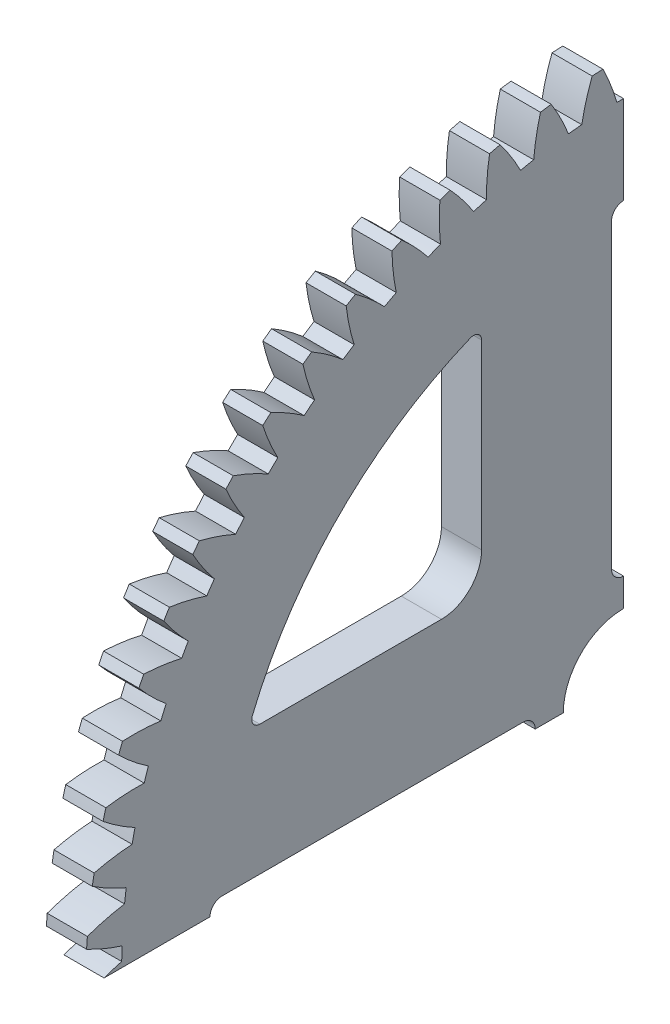
from build123d import *

# Parameters (mm, degrees)
BASPROSKE_W             = 10
BASPROSKE_H             = 134
TOOTHCUT_DEPTH          = 190.768279752
TEETHCUTS_COUNT         = 65
TEETHCUTS_ANGLE         = 354.461538462
HUBNEAONESKE_R          = 6
HUBNEARONE_DEPTH        = 40.0000508
BORSKE_R                = 4
BORE_DEPTH              = 50.0000508
ENL_V_MAT_EXTRU_1_DEPTH = 10
ENL_V_MAT_EXTRU_2_DEPTH = 5
CONG_1_R                = 10
CONG_2_R                = 2
ENL_V_MAT_EXTRU_3_DEPTH = 194.670907796
CONG_3_R                = 10
CONG_4_R                = 2
CONG_5_R                = 1
ESQUISSE5_R             = 11
ESQUISSE5_R_2           = 6
BOSS_EXTRU_1_DEPTH      = 17
CONG_6_SIZE             = 2
CONG_6_SIZE_2           = 10
BOSS_EXTRU_2_START      = -30
BOSS_EXTRU_2_DEPTH      = 30
BOSS_EXTRU_3_START      = 20.0000508
ESQUISSE7_R             = 4
BOSS_EXTRU_3_DEPTH      = 20.0000508
ENL_V_START             = -23
ESQUISSE8_R             = 6
ESQUISSE8_R_2           = 5.9
ENL_V_MAT_EXTRU_4_DEPTH = 23
ESQUISSE9_R             = 15
ENL_V_MAT_EXTRU_6_DEPTH = 192.855196601
ENL_V_MAT_EXTRU_7_DEPTH = 10


with BuildPart() as part:
    # BasProSke → Base-Revolve (revolve)
    with BuildSketch(Plane(origin=(0, 0, 0), x_dir=(1, 0, 0), z_dir=(0, 1, 0)), mode=Mode.PRIVATE) as base_revolve_sk:
        with Locations((5, 67)):
            Rectangle(BASPROSKE_W, BASPROSKE_H)
    revolve(base_revolve_sk.sketch.rotate(Axis((-10, 0, 0), (1, 0, 0)), 180), axis=Axis((-10, 0, 0), (1, 0, 0)))

    # TooCutSke → ToothCut (cut, through all)
    with BuildSketch(Plane(origin=(0, 0, 0), x_dir=(0, 0, -1), z_dir=(1, 0, 0))):
        with BuildLine():
            ThreePointArc((1.667679112, 124.987874801), (0, 124.999), (-1.667679112, 124.987874801))
            ThreePointArc((-1.667679112, 124.987874801), (-3.198590853, 129.537570146), (-5.142534786, 133.926704511))
            ThreePointArc((-5.142534786, 133.926704511), (0, 134.0254), (5.142534786, 133.926704511))
            ThreePointArc((5.142534786, 133.926704511), (3.198590853, 129.537570146), (1.667679112, 124.987874801))
        make_face()
    toothcut = extrude(amount=TOOTHCUT_DEPTH, mode=Mode.SUBTRACT)

    # TeethCuts: ToothCut ×65 about axis
    teethcuts_axis = Axis((-10, 0, 0), (1, 0, 0))
    for i in range(1, TEETHCUTS_COUNT):
        add(toothcut.rotate(teethcuts_axis, i * TEETHCUTS_ANGLE / (TEETHCUTS_COUNT - 1)), mode=Mode.SUBTRACT)

    # HubNeaOneSke → HubNearOne (add)
    with BuildSketch(Plane.ZY):
        with Locations(Location((0, 0, 0), (0, 0, 180))):
            Circle(HUBNEAONESKE_R)
    extrude(amount=HUBNEARONE_DEPTH)

    # BorSke → Bore (cut, symmetric)
    with BuildSketch(Plane(origin=(0, 0, 0), x_dir=(0, 0, -1), z_dir=(1, 0, 0))):
        with Locations(Location((0, 0, 0), (0, 0, 180))):
            Circle(BORSKE_R)
    extrude(amount=BORE_DEPTH, both=True, mode=Mode.SUBTRACT)

    # Esquisse1 → Enlèv. mat.-Extru.1 (cut)
    with BuildSketch(Plane(origin=(10, 0, 0), x_dir=(0, 0, -1), z_dir=(1, 0, 0))):
        with BuildLine():
            Line((3, 100), (3, 25))
            Line((3, 25), (-3, 25))
            Line((-3, 25), (-3, 100))
            ThreePointArc((-3, 100), (0, 103), (3, 100))
        make_face()
        with BuildLine():
            Line((-3, 25), (3, 25))
            ThreePointArc((3, 25), (0, 22), (-3, 25))
        make_face()
        with BuildLine():
            Line((100, 3), (25, 3))
            ThreePointArc((25, 3), (22, 0), (25, -3))
            Line((25, -3), (100, -3))
            ThreePointArc((100, -3), (103, 0), (100, 3))
        make_face()
        with BuildLine():
            Line((-100, -3), (-25, -3))
            ThreePointArc((-25, -3), (-22, 0), (-25, 3))
            Line((-25, 3), (-100, 3))
            ThreePointArc((-100, 3), (-103, 0), (-100, -3))
        make_face()
        with BuildLine():
            Line((3, -100), (3, -25))
            ThreePointArc((3, -25), (0, -22), (-3, -25))
            Line((-3, -25), (-3, -100))
            ThreePointArc((-3, -100), (0, -103), (3, -100))
        make_face()
    extrude(amount=-ENL_V_MAT_EXTRU_1_DEPTH, mode=Mode.SUBTRACT)

    # Esquisse3 → Enlèv. mat.-Extru.2 (cut)
    with BuildSketch(Plane.ZY):
        Polygon((-113, -8), (-113, -18), (-18, -18), (-18, -113), (-8, -113), (-8, -12), (-12, -12), (-12, -8), align=None)
        Polygon((-113, 8), (-12, 8), (-12, 12), (-8, 12), (-8, 113), (-18, 113), (-18, 18), (-113, 18), align=None)
        Polygon((8, 113), (8, 12), (12, 12), (12, 8), (113, 8), (113, 18), (18, 18), (18, 113), align=None)
        Polygon((113, -8), (12, -8), (12, -12), (8, -12), (8, -113), (18, -113), (18, -18), (113, -18), align=None)
    extrude(amount=-ENL_V_MAT_EXTRU_2_DEPTH, mode=Mode.SUBTRACT)

    # Congé1
    # the kernel refuses this fillet: 10 mm, written as the material it takes off along each edge
    with BuildSketch(Plane(origin=(-25, -18, -18), x_dir=(0, 0, -1), z_dir=(1, 0, 0)), Plane(origin=(-25, 18, -18), x_dir=(0, 1, 0), z_dir=(1, 0, 0)), Plane(origin=(-25, 18, 18), x_dir=(0, 0, 1), z_dir=(1, 0, 0)), Plane(origin=(-25, -18, 18), x_dir=(0, -1, 0), z_dir=(1, 0, 0))) as cong_1_piece_1:
        with BuildLine():
            CenterArc((CONG_1_R, -CONG_1_R), CONG_1_R, 90, 90)
            Line((0, -CONG_1_R), (0, 0))
            Line((0, 0), (CONG_1_R, 0))
        make_face()
    extrude(amount=30, mode=Mode.SUBTRACT)
    with BuildSketch(Plane(origin=(-10, -12, 12), x_dir=(0, 1, 0), z_dir=(1, 0, 0)), Plane(origin=(-10, -12, -12), x_dir=(0, 0, 1), z_dir=(1, 0, 0)), Plane(origin=(-10, 12, 12), x_dir=(0, 0, -1), z_dir=(1, 0, 0)), Plane(origin=(-10, 12, -12), x_dir=(0, -1, 0), z_dir=(1, 0, 0))) as cong_1_piece_2:
        with BuildLine():
            CenterArc((8.782329983, -8.782329983), CONG_1_R, 118.570059811, 32.859880379)
            Line((0, -4), (0, 0))
            Line((0, 0), (4, 0))
        make_face()
    extrude(amount=15, mode=Mode.SUBTRACT)

    # Congé2
    cong_2_edges = [part.edges().sort_by_distance(p)[0] for p in [
        (2.5, 18, 113),
        (2.5, 8, 113),
        (2.5, 113, 8),
        (2.5, 113, 18),
        (2.5, 8, -113),
        (2.5, 18, -113),
        (2.5, 113, -18),
        (2.5, 113, -8),
        (2.5, -8, -113),
        (2.5, -113, -8),
        (2.5, -113, -18),
        (2.5, -18, -113),
        (2.5, -113, 18),
        (2.5, -113, 8),
        (2.5, -8, 113),
        (2.5, -18, 113),
    ]]
    fillet(cong_2_edges, radius=CONG_2_R)

    # Esquisse4 → Enlèv. mat.-Extru.3 (cut, through all)
    with BuildSketch(Plane.ZY):
        with BuildLine():
            Line((-93.541434669, 35.355339059), (-35.355339059, 35.355339059))
            Line((-35.355339059, 35.355339059), (-35.355339059, 93.541434669))
            ThreePointArc((-35.355339059, 93.541434669), (-70.710678119, 70.710678119), (-93.541434669, 35.355339059))
        make_face()
        with BuildLine():
            Line((35.355339059, 93.541434669), (35.355339059, 35.355339059))
            Line((35.355339059, 35.355339059), (93.541434669, 35.355339059))
            ThreePointArc((93.541434669, 35.355339059), (70.710678119, 70.710678119), (35.355339059, 93.541434669))
        make_face()
        with BuildLine():
            Line((93.541434669, -35.355339059), (35.355339059, -35.355339059))
            Line((35.355339059, -35.355339059), (35.355339059, -93.541434669))
            ThreePointArc((35.355339059, -93.541434669), (70.710678119, -70.710678119), (93.541434669, -35.355339059))
        make_face()
        with BuildLine():
            Line((-35.355339059, -93.541434669), (-35.355339059, -35.355339059))
            Line((-35.355339059, -35.355339059), (-93.541434669, -35.355339059))
            ThreePointArc((-93.541434669, -35.355339059), (-70.710678119, -70.710678119), (-35.355339059, -93.541434669))
        make_face()
    extrude(amount=-ENL_V_MAT_EXTRU_3_DEPTH, mode=Mode.SUBTRACT)

    # Congé3
    cong_3_edges = [part.edges().sort_by_distance(p)[0] for p in [
        (5, 35.355339059, -35.355339059),
        (5, 35.355339059, 35.355339059),
        (5, -35.355339059, 35.355339059),
        (5, -35.355339059, -35.355339059),
    ]]
    fillet(cong_3_edges, radius=CONG_3_R)

    # Congé4
    cong_4_edges = [part.edges().sort_by_distance(p)[0] for p in [
        (5, 35.355339059, -93.541434669),
        (5, 93.541434669, -35.355339059),
        (5, 93.541434669, 35.355339059),
        (5, 35.355339059, 93.541434669),
        (5, -35.355339059, 93.541434669),
        (5, -93.541434669, 35.355339059),
        (5, -93.541434669, -35.355339059),
        (5, -35.355339059, -93.541434669),
    ]]
    fillet(cong_4_edges, radius=CONG_4_R)

    # Congé5
    # the kernel refuses this fillet: 1 mm, written as the material it takes off along each edge
    with BuildSketch(Plane(origin=(0, 8, 9.5), x_dir=(0, -1, 0), z_dir=(0, 0, 1))) as cong_5_piece_1_section:
        with BuildLine():
            CenterArc((CONG_5_R, CONG_5_R), CONG_5_R, 180, 90)
            Line((0, CONG_5_R), (0, 0))
            Line((0, 0), (CONG_5_R, 0))
        make_face()
    cong_5_piece_1 = extrude(amount=101.5, mode=Mode.PRIVATE)
    cong_5_piece_1 = cong_5_piece_1 - Plane(origin=(0, 3.217670017, 3.217670017), x_dir=(0, 0, -1), z_dir=(-1, 0, 0)) * Cylinder(10, 208, mode=Mode.PRIVATE)
    with BuildSketch(Plane(origin=(0, 9.5, -8), x_dir=(0, 0, 1), z_dir=(0, 1, 0))) as cong_5_piece_2_section:
        with BuildLine():
            CenterArc((CONG_5_R, CONG_5_R), CONG_5_R, 180, 90)
            Line((0, CONG_5_R), (0, 0))
            Line((0, 0), (CONG_5_R, 0))
        make_face()
    cong_5_piece_2 = extrude(amount=101.5, mode=Mode.PRIVATE)
    cong_5_piece_2 = cong_5_piece_2 - Plane(origin=(0, 3.217670017, -3.217670017), x_dir=(0, -1, 0), z_dir=(-1, 0, 0)) * Cylinder(10, 207, mode=Mode.PRIVATE)
    with BuildSketch(Plane(origin=(0, -8, -9.5), x_dir=(0, 1, 0), z_dir=(0, 0, -1))) as cong_5_piece_3_section:
        with BuildLine():
            CenterArc((CONG_5_R, CONG_5_R), CONG_5_R, 180, 90)
            Line((0, CONG_5_R), (0, 0))
            Line((0, 0), (CONG_5_R, 0))
        make_face()
    cong_5_piece_3 = extrude(amount=101.5, mode=Mode.PRIVATE)
    cong_5_piece_3 = cong_5_piece_3 - Plane(origin=(0, -3.217670017, -3.217670017), x_dir=(0, 0, 1), z_dir=(-1, 0, 0)) * Cylinder(10, 207, mode=Mode.PRIVATE)
    with BuildSketch(Plane(origin=(0, -9.5, 8), x_dir=(0, 0, -1), z_dir=(0, -1, 0))) as cong_5_piece_4_section:
        with BuildLine():
            CenterArc((CONG_5_R, CONG_5_R), CONG_5_R, 180, 90)
            Line((0, CONG_5_R), (0, 0))
            Line((0, 0), (CONG_5_R, 0))
        make_face()
    cong_5_piece_4 = extrude(amount=101.5, mode=Mode.PRIVATE)
    cong_5_piece_4 = cong_5_piece_4 - Plane(origin=(0, -3.217670017, 3.217670017), x_dir=(0, 1, 0), z_dir=(-1, 0, 0)) * Cylinder(10, 207, mode=Mode.PRIVATE)
    with BuildSketch(Plane(origin=(0, -28, -18), x_dir=(0, 0, -1), z_dir=(0, -1, 0)), Plane(origin=(0, 18, -28), x_dir=(0, 1, 0), z_dir=(0, 0, -1)), Plane(origin=(0, -18, 28), x_dir=(0, -1, 0), z_dir=(0, 0, 1)), Plane(origin=(0, 28, 18), x_dir=(0, 0, 1), z_dir=(0, 1, 0)), Plane(origin=(0, 111, -18), x_dir=(0, 0, -1), z_dir=(0, -1, 0)), Plane(origin=(0, 18, 111), x_dir=(0, 1, 0), z_dir=(0, 0, -1)), Plane(origin=(0, -111, 18), x_dir=(0, 0, 1), z_dir=(0, 1, 0)), Plane(origin=(0, -18, -111), x_dir=(0, -1, 0), z_dir=(0, 0, 1))) as cong_5_piece_5:
        with BuildLine():
            CenterArc((CONG_5_R, CONG_5_R), CONG_5_R, 180, 90)
            Line((0, CONG_5_R), (0, 0))
            Line((0, 0), (CONG_5_R, 0))
        make_face()
    cong_5_piece_5_solid = extrude(amount=83, mode=Mode.PRIVATE)
    with BuildSketch(Plane(origin=(0, 3.217670017, -3.217670017), x_dir=(0, 0.9692508920434058, -0.24607459900010414), z_dir=(0, 0.24607459900010414, 0.9692508920434058))) as cong_5_piece_6_section:
        with BuildLine():
            CenterArc((10 - CONG_5_R, -CONG_5_R), CONG_5_R, 0, 90)
            Line((10, -CONG_5_R), (10, 0))
            Line((10, 0), (10 - CONG_5_R, 0))
        make_face()
    cong_5_piece_6 = revolve(axis=Axis((0, 3.217670017, -3.217670017), (-1, 0, 0)), revolution_arc=61.509303849, mode=Mode.PRIVATE)
    cong_5_piece_6 = split(cong_5_piece_6, bisect_by=Plane(origin=(0, 8, -3.217670017), z_dir=(0, 1, 0)), keep=Keep.TOP, mode=Mode.PRIVATE)
    cong_5_piece_6 = split(cong_5_piece_6, bisect_by=Plane(origin=(0, 3.217670017, -8), z_dir=(0, 0, -1)), keep=Keep.TOP, mode=Mode.PRIVATE)
    with BuildSketch(Plane(origin=(0, 3.217670017, 3.217670017), x_dir=(0, 0.24607459900010414, 0.9692508920434058), z_dir=(0, -0.9692508920434058, 0.24607459900010414))) as cong_5_piece_7_section:
        with BuildLine():
            CenterArc((10 - CONG_5_R, -CONG_5_R), CONG_5_R, 0, 90)
            Line((10, -CONG_5_R), (10, 0))
            Line((10, 0), (10 - CONG_5_R, 0))
        make_face()
    cong_5_piece_7 = revolve(axis=Axis((0, 3.217670017, 3.217670017), (-1, 0, 0)), revolution_arc=61.509303849, mode=Mode.PRIVATE)
    cong_5_piece_7 = split(cong_5_piece_7, bisect_by=Plane(origin=(0, 3.217670017, 8), z_dir=(0, 0, 1)), keep=Keep.TOP, mode=Mode.PRIVATE)
    cong_5_piece_7 = split(cong_5_piece_7, bisect_by=Plane(origin=(0, 8, 3.217670017), z_dir=(0, 1, 0)), keep=Keep.TOP, mode=Mode.PRIVATE)
    with BuildSketch(Plane(origin=(0, -3.217670017, -3.217670017), x_dir=(0, -0.24607459900010414, -0.9692508920434058), z_dir=(0, 0.9692508920434058, -0.24607459900010414))) as cong_5_piece_8_section:
        with BuildLine():
            CenterArc((10 - CONG_5_R, -CONG_5_R), CONG_5_R, 0, 90)
            Line((10, -CONG_5_R), (10, 0))
            Line((10, 0), (10 - CONG_5_R, 0))
        make_face()
    cong_5_piece_8 = revolve(axis=Axis((0, -3.217670017, -3.217670017), (-1, 0, 0)), revolution_arc=61.509303849, mode=Mode.PRIVATE)
    cong_5_piece_8 = split(cong_5_piece_8, bisect_by=Plane(origin=(0, -8, -3.217670017), z_dir=(0, -1, 0)), keep=Keep.TOP, mode=Mode.PRIVATE)
    cong_5_piece_8 = split(cong_5_piece_8, bisect_by=Plane(origin=(0, -3.217670017, -8), z_dir=(0, 0, -1)), keep=Keep.TOP, mode=Mode.PRIVATE)
    with BuildSketch(Plane(origin=(0, -3.217670017, 3.217670017), x_dir=(0, -0.9692508920434058, 0.24607459900010414), z_dir=(0, -0.24607459900010414, -0.9692508920434058))) as cong_5_piece_9_section:
        with BuildLine():
            CenterArc((10 - CONG_5_R, -CONG_5_R), CONG_5_R, 0, 90)
            Line((10, -CONG_5_R), (10, 0))
            Line((10, 0), (10 - CONG_5_R, 0))
        make_face()
    cong_5_piece_9 = revolve(axis=Axis((0, -3.217670017, 3.217670017), (-1, 0, 0)), revolution_arc=61.509303849, mode=Mode.PRIVATE)
    cong_5_piece_9 = split(cong_5_piece_9, bisect_by=Plane(origin=(0, -8, 3.217670017), z_dir=(0, -1, 0)), keep=Keep.TOP, mode=Mode.PRIVATE)
    cong_5_piece_9 = split(cong_5_piece_9, bisect_by=Plane(origin=(0, -3.217670017, 8), z_dir=(0, 0, 1)), keep=Keep.TOP, mode=Mode.PRIVATE)
    with BuildSketch(Plane(origin=(0, -28, 28), x_dir=(0, 1, 0), z_dir=(0, 0, 1))) as cong_5_piece_10:
        with BuildLine():
            CenterArc((10 - CONG_5_R, -CONG_5_R), CONG_5_R, 0, 90)
            Line((10, -CONG_5_R), (10, 0))
            Line((10, 0), (10 - CONG_5_R, 0))
        make_face()
    cong_5_piece_10_solid = revolve(axis=Axis((0, -28, 28), (-1, 0, 0)), revolution_arc=90, mode=Mode.PRIVATE)
    with BuildSketch(Plane(origin=(0, 28, 28), x_dir=(0, 0, -1), z_dir=(0, 1, 0))) as cong_5_piece_11:
        with BuildLine():
            CenterArc((10 - CONG_5_R, -CONG_5_R), CONG_5_R, 0, 90)
            Line((10, -CONG_5_R), (10, 0))
            Line((10, 0), (10 - CONG_5_R, 0))
        make_face()
    cong_5_piece_11_solid = revolve(axis=Axis((0, 28, 28), (-1, 0, 0)), revolution_arc=90, mode=Mode.PRIVATE)
    with BuildSketch(Plane(origin=(0, 28, -28), x_dir=(0, -1, 0), z_dir=(0, 0, -1))) as cong_5_piece_12:
        with BuildLine():
            CenterArc((10 - CONG_5_R, -CONG_5_R), CONG_5_R, 0, 90)
            Line((10, -CONG_5_R), (10, 0))
            Line((10, 0), (10 - CONG_5_R, 0))
        make_face()
    cong_5_piece_12_solid = revolve(axis=Axis((0, 28, -28), (-1, 0, 0)), revolution_arc=90, mode=Mode.PRIVATE)
    with BuildSketch(Plane(origin=(0, -28, -28), x_dir=(0, 0, 1), z_dir=(0, -1, 0))) as cong_5_piece_13:
        with BuildLine():
            CenterArc((10 - CONG_5_R, -CONG_5_R), CONG_5_R, 0, 90)
            Line((10, -CONG_5_R), (10, 0))
            Line((10, 0), (10 - CONG_5_R, 0))
        make_face()
    cong_5_piece_13_solid = revolve(axis=Axis((0, -28, -28), (-1, 0, 0)), revolution_arc=90, mode=Mode.PRIVATE)
    with BuildSketch(Plane(origin=(0, 113, -10), x_dir=(0, 1, 0), z_dir=(0, 0, -1)), Plane(origin=(0, 113, 16), x_dir=(0, 1, 0), z_dir=(0, 0, -1)), Plane(origin=(0, 10, 113), x_dir=(0, 0, 1), z_dir=(0, 1, 0)), Plane(origin=(0, -16, 113), x_dir=(0, 0, 1), z_dir=(0, 1, 0)), Plane(origin=(0, -113, 10), x_dir=(0, -1, 0), z_dir=(0, 0, 1)), Plane(origin=(0, -113, -16), x_dir=(0, -1, 0), z_dir=(0, 0, 1)), Plane(origin=(0, -10, -113), x_dir=(0, 0, -1), z_dir=(0, -1, 0)), Plane(origin=(0, 16, -113), x_dir=(0, 0, -1), z_dir=(0, -1, 0))) as cong_5_piece_14:
        with BuildLine():
            CenterArc((CONG_5_R, CONG_5_R), CONG_5_R, 180, 90)
            Line((0, CONG_5_R), (0, 0))
            Line((0, 0), (CONG_5_R, 0))
        make_face()
    cong_5_piece_14_solid = extrude(amount=6, mode=Mode.PRIVATE)
    with BuildSketch(Plane(origin=(0, 111, 8), x_dir=(0, 0, -1), z_dir=(0, -1, 0))) as cong_5_piece_15_section:
        with BuildLine():
            CenterArc((CONG_5_R, CONG_5_R), CONG_5_R, 180, 90)
            Line((0, CONG_5_R), (0, 0))
            Line((0, 0), (CONG_5_R, 0))
        make_face()
    cong_5_piece_15 = extrude(amount=101.5, mode=Mode.PRIVATE)
    cong_5_piece_15 = cong_5_piece_15 - Plane(origin=(0, 3.217670017, 3.217670017), x_dir=(0, 0, -1), z_dir=(-1, 0, 0)) * Cylinder(10, 207, mode=Mode.PRIVATE)
    with BuildSketch(Plane(origin=(0, -8, 111), x_dir=(0, 1, 0), z_dir=(0, 0, -1))) as cong_5_piece_16_section:
        with BuildLine():
            CenterArc((CONG_5_R, CONG_5_R), CONG_5_R, 180, 90)
            Line((0, CONG_5_R), (0, 0))
            Line((0, 0), (CONG_5_R, 0))
        make_face()
    cong_5_piece_16 = extrude(amount=101.5, mode=Mode.PRIVATE)
    cong_5_piece_16 = cong_5_piece_16 - Plane(origin=(0, -3.217670017, 3.217670017), x_dir=(0, 1, 0), z_dir=(-1, 0, 0)) * Cylinder(10, 207, mode=Mode.PRIVATE)
    with BuildSketch(Plane(origin=(0, -111, -8), x_dir=(0, 0, 1), z_dir=(0, 1, 0))) as cong_5_piece_17_section:
        with BuildLine():
            CenterArc((CONG_5_R, CONG_5_R), CONG_5_R, 180, 90)
            Line((0, CONG_5_R), (0, 0))
            Line((0, 0), (CONG_5_R, 0))
        make_face()
    cong_5_piece_17 = extrude(amount=101.5, mode=Mode.PRIVATE)
    cong_5_piece_17 = cong_5_piece_17 - Plane(origin=(0, -3.217670017, -3.217670017), x_dir=(0, 0, 1), z_dir=(-1, 0, 0)) * Cylinder(10, 207, mode=Mode.PRIVATE)
    with BuildSketch(Plane(origin=(0, 8, -111), x_dir=(0, -1, 0), z_dir=(0, 0, 1))) as cong_5_piece_18_section:
        with BuildLine():
            CenterArc((CONG_5_R, CONG_5_R), CONG_5_R, 180, 90)
            Line((0, CONG_5_R), (0, 0))
            Line((0, 0), (CONG_5_R, 0))
        make_face()
    cong_5_piece_18 = extrude(amount=101.5, mode=Mode.PRIVATE)
    cong_5_piece_18 = cong_5_piece_18 - Plane(origin=(0, 3.217670017, -3.217670017), x_dir=(0, -1, 0), z_dir=(-1, 0, 0)) * Cylinder(10, 207, mode=Mode.PRIVATE)
    with BuildSketch(Plane(origin=(0, 111, -16), x_dir=(0, 1, 0), z_dir=(0, 0, 1))) as cong_5_piece_19:
        with BuildLine():
            CenterArc((2 + CONG_5_R, -CONG_5_R), CONG_5_R, 90, 90)
            Line((2, -CONG_5_R), (2, 0))
            Line((2, 0), (2 + CONG_5_R, 0))
        make_face()
    cong_5_piece_19_solid = revolve(axis=Axis((0, 111, -16), (-1, 0, 0)), revolution_arc=90, mode=Mode.PRIVATE)
    with BuildSketch(Plane(origin=(0, 111, -10), x_dir=(0, 0, 1), z_dir=(0, -1, 0))) as cong_5_piece_20:
        with BuildLine():
            CenterArc((2 + CONG_5_R, -CONG_5_R), CONG_5_R, 90, 90)
            Line((2, -CONG_5_R), (2, 0))
            Line((2, 0), (2 + CONG_5_R, 0))
        make_face()
    cong_5_piece_20_solid = revolve(axis=Axis((0, 111, -10), (-1, 0, 0)), revolution_arc=90, mode=Mode.PRIVATE)
    with BuildSketch(Plane(origin=(0, 111, 10), x_dir=(0, 0, -1), z_dir=(0, -1, 0))) as cong_5_piece_21:
        with BuildLine():
            CenterArc((2 + CONG_5_R, CONG_5_R), CONG_5_R, 180, 90)
            Line((2, CONG_5_R), (2, 0))
            Line((2, 0), (2 + CONG_5_R, 0))
        make_face()
    cong_5_piece_21_solid = revolve(axis=Axis((0, 111, 10), (1, 0, 0)), revolution_arc=90, mode=Mode.PRIVATE)
    with BuildSketch(Plane(origin=(0, 111, 16), x_dir=(0, 0, 1), z_dir=(0, -1, 0))) as cong_5_piece_22:
        with BuildLine():
            CenterArc((2 + CONG_5_R, -CONG_5_R), CONG_5_R, 90, 90)
            Line((2, -CONG_5_R), (2, 0))
            Line((2, 0), (2 + CONG_5_R, 0))
        make_face()
    cong_5_piece_22_solid = revolve(axis=Axis((0, 111, 16), (-1, 0, 0)), revolution_arc=90, mode=Mode.PRIVATE)
    with BuildSketch(Plane(origin=(0, 16, 111), x_dir=(0, 0, 1), z_dir=(0, -1, 0))) as cong_5_piece_23:
        with BuildLine():
            CenterArc((2 + CONG_5_R, -CONG_5_R), CONG_5_R, 90, 90)
            Line((2, -CONG_5_R), (2, 0))
            Line((2, 0), (2 + CONG_5_R, 0))
        make_face()
    cong_5_piece_23_solid = revolve(axis=Axis((0, 16, 111), (-1, 0, 0)), revolution_arc=90, mode=Mode.PRIVATE)
    with BuildSketch(Plane(origin=(0, 10, 111), x_dir=(0, -1, 0), z_dir=(0, 0, -1))) as cong_5_piece_24:
        with BuildLine():
            CenterArc((2 + CONG_5_R, -CONG_5_R), CONG_5_R, 90, 90)
            Line((2, -CONG_5_R), (2, 0))
            Line((2, 0), (2 + CONG_5_R, 0))
        make_face()
    cong_5_piece_24_solid = revolve(axis=Axis((0, 10, 111), (-1, 0, 0)), revolution_arc=90, mode=Mode.PRIVATE)
    with BuildSketch(Plane(origin=(0, -10, 111), x_dir=(0, 1, 0), z_dir=(0, 0, -1))) as cong_5_piece_25:
        with BuildLine():
            CenterArc((2 + CONG_5_R, CONG_5_R), CONG_5_R, 180, 90)
            Line((2, CONG_5_R), (2, 0))
            Line((2, 0), (2 + CONG_5_R, 0))
        make_face()
    cong_5_piece_25_solid = revolve(axis=Axis((0, -10, 111), (1, 0, 0)), revolution_arc=90, mode=Mode.PRIVATE)
    with BuildSketch(Plane(origin=(0, -16, 111), x_dir=(0, -1, 0), z_dir=(0, 0, -1))) as cong_5_piece_26:
        with BuildLine():
            CenterArc((2 + CONG_5_R, -CONG_5_R), CONG_5_R, 90, 90)
            Line((2, -CONG_5_R), (2, 0))
            Line((2, 0), (2 + CONG_5_R, 0))
        make_face()
    cong_5_piece_26_solid = revolve(axis=Axis((0, -16, 111), (-1, 0, 0)), revolution_arc=90, mode=Mode.PRIVATE)
    with BuildSketch(Plane(origin=(0, -111, 16), x_dir=(0, -1, 0), z_dir=(0, 0, -1))) as cong_5_piece_27:
        with BuildLine():
            CenterArc((2 + CONG_5_R, -CONG_5_R), CONG_5_R, 90, 90)
            Line((2, -CONG_5_R), (2, 0))
            Line((2, 0), (2 + CONG_5_R, 0))
        make_face()
    cong_5_piece_27_solid = revolve(axis=Axis((0, -111, 16), (-1, 0, 0)), revolution_arc=90, mode=Mode.PRIVATE)
    with BuildSketch(Plane(origin=(0, -111, 10), x_dir=(0, 0, -1), z_dir=(0, 1, 0))) as cong_5_piece_28:
        with BuildLine():
            CenterArc((2 + CONG_5_R, -CONG_5_R), CONG_5_R, 90, 90)
            Line((2, -CONG_5_R), (2, 0))
            Line((2, 0), (2 + CONG_5_R, 0))
        make_face()
    cong_5_piece_28_solid = revolve(axis=Axis((0, -111, 10), (-1, 0, 0)), revolution_arc=90, mode=Mode.PRIVATE)
    with BuildSketch(Plane(origin=(0, -111, -10), x_dir=(0, -1, 0), z_dir=(0, 0, -1))) as cong_5_piece_29:
        with BuildLine():
            CenterArc((2 + CONG_5_R, -CONG_5_R), CONG_5_R, 90, 90)
            Line((2, -CONG_5_R), (2, 0))
            Line((2, 0), (2 + CONG_5_R, 0))
        make_face()
    cong_5_piece_29_solid = revolve(axis=Axis((0, -111, -10), (-1, 0, 0)), revolution_arc=90, mode=Mode.PRIVATE)
    with BuildSketch(Plane(origin=(0, -111, -16), x_dir=(0, 0, -1), z_dir=(0, 1, 0))) as cong_5_piece_30:
        with BuildLine():
            CenterArc((2 + CONG_5_R, -CONG_5_R), CONG_5_R, 90, 90)
            Line((2, -CONG_5_R), (2, 0))
            Line((2, 0), (2 + CONG_5_R, 0))
        make_face()
    cong_5_piece_30_solid = revolve(axis=Axis((0, -111, -16), (-1, 0, 0)), revolution_arc=90, mode=Mode.PRIVATE)
    with BuildSketch(Plane(origin=(0, -16, -111), x_dir=(0, 0, -1), z_dir=(0, 1, 0))) as cong_5_piece_31:
        with BuildLine():
            CenterArc((2 + CONG_5_R, -CONG_5_R), CONG_5_R, 90, 90)
            Line((2, -CONG_5_R), (2, 0))
            Line((2, 0), (2 + CONG_5_R, 0))
        make_face()
    cong_5_piece_31_solid = revolve(axis=Axis((0, -16, -111), (-1, 0, 0)), revolution_arc=90, mode=Mode.PRIVATE)
    with BuildSketch(Plane(origin=(0, -10, -111), x_dir=(0, 0, -1), z_dir=(0, -1, 0))) as cong_5_piece_32:
        with BuildLine():
            CenterArc((2 + CONG_5_R, CONG_5_R), CONG_5_R, 180, 90)
            Line((2, CONG_5_R), (2, 0))
            Line((2, 0), (2 + CONG_5_R, 0))
        make_face()
    cong_5_piece_32_solid = revolve(axis=Axis((0, -10, -111), (1, 0, 0)), revolution_arc=90, mode=Mode.PRIVATE)
    with BuildSketch(Plane(origin=(0, 10, -111), x_dir=(0, -1, 0), z_dir=(0, 0, 1))) as cong_5_piece_33:
        with BuildLine():
            CenterArc((2 + CONG_5_R, CONG_5_R), CONG_5_R, 180, 90)
            Line((2, CONG_5_R), (2, 0))
            Line((2, 0), (2 + CONG_5_R, 0))
        make_face()
    cong_5_piece_33_solid = revolve(axis=Axis((0, 10, -111), (1, 0, 0)), revolution_arc=90, mode=Mode.PRIVATE)
    with BuildSketch(Plane(origin=(0, 16, -111), x_dir=(0, 1, 0), z_dir=(0, 0, 1))) as cong_5_piece_34:
        with BuildLine():
            CenterArc((2 + CONG_5_R, -CONG_5_R), CONG_5_R, 90, 90)
            Line((2, -CONG_5_R), (2, 0))
            Line((2, 0), (2 + CONG_5_R, 0))
        make_face()
    cong_5_piece_34_solid = revolve(axis=Axis((0, 16, -111), (-1, 0, 0)), revolution_arc=90, mode=Mode.PRIVATE)
    with BuildSketch(Plane(origin=(0, 3.217670017, 3.217670017), x_dir=(0, 0.24607459900010414, 0.9692508920434058), z_dir=(0, -0.9692508920434058, 0.24607459900010414))) as cong_5_piece_35a_section:
        with BuildLine():
            CenterArc((10 - CONG_5_R, -CONG_5_R), CONG_5_R, 0, 90)
            Line((10, -CONG_5_R), (10, 0))
            Line((10, 0), (10 - CONG_5_R, 0))
        make_face()
    cong_5_piece_35a = revolve(axis=Axis((0, 3.217670017, 3.217670017), (-1, 0, 0)), revolution_arc=61.509303849, mode=Mode.PRIVATE)
    cong_5_piece_35a = split(cong_5_piece_35a, bisect_by=Plane(origin=(0, 8, 3.217670017), z_dir=(0, -1, 0)), keep=Keep.TOP, mode=Mode.PRIVATE)
    with BuildSketch(Plane(origin=(0, 8, 9.5), x_dir=(0, -1, 0), z_dir=(0, 0, 1))) as cong_5_piece_35b_section:
        with BuildLine():
            CenterArc((CONG_5_R, CONG_5_R), CONG_5_R, 180, 90)
            Line((0, CONG_5_R), (0, 0))
            Line((0, 0), (CONG_5_R, 0))
        make_face()
    cong_5_piece_35b = extrude(amount=101.5, mode=Mode.PRIVATE)
    cong_5_piece_35b = cong_5_piece_35b & Plane(origin=(0, 3.217670017, 3.217670017), x_dir=(0, 0, -1), z_dir=(-1, 0, 0)) * Cylinder(10, 208, mode=Mode.PRIVATE)
    cong_5_piece_35 = cong_5_piece_35a & cong_5_piece_35b
    with BuildSketch(Plane(origin=(0, 3.217670017, -3.217670017), x_dir=(0, 0.9692508920434058, -0.24607459900010414), z_dir=(0, 0.24607459900010414, 0.9692508920434058))) as cong_5_piece_36a_section:
        with BuildLine():
            CenterArc((10 - CONG_5_R, -CONG_5_R), CONG_5_R, 0, 90)
            Line((10, -CONG_5_R), (10, 0))
            Line((10, 0), (10 - CONG_5_R, 0))
        make_face()
    cong_5_piece_36a = revolve(axis=Axis((0, 3.217670017, -3.217670017), (-1, 0, 0)), revolution_arc=61.509303849, mode=Mode.PRIVATE)
    cong_5_piece_36a = split(cong_5_piece_36a, bisect_by=Plane(origin=(0, 3.217670017, -8), z_dir=(0, 0, 1)), keep=Keep.TOP, mode=Mode.PRIVATE)
    with BuildSketch(Plane(origin=(0, 9.5, -8), x_dir=(0, 0, 1), z_dir=(0, 1, 0))) as cong_5_piece_36b_section:
        with BuildLine():
            CenterArc((CONG_5_R, CONG_5_R), CONG_5_R, 180, 90)
            Line((0, CONG_5_R), (0, 0))
            Line((0, 0), (CONG_5_R, 0))
        make_face()
    cong_5_piece_36b = extrude(amount=101.5, mode=Mode.PRIVATE)
    cong_5_piece_36b = cong_5_piece_36b & Plane(origin=(0, 3.217670017, -3.217670017), x_dir=(0, -1, 0), z_dir=(-1, 0, 0)) * Cylinder(10, 207, mode=Mode.PRIVATE)
    cong_5_piece_36 = cong_5_piece_36a & cong_5_piece_36b
    with BuildSketch(Plane(origin=(0, -8, -9.5), x_dir=(0, 1, 0), z_dir=(0, 0, -1))) as cong_5_piece_37a_section:
        with BuildLine():
            CenterArc((CONG_5_R, CONG_5_R), CONG_5_R, 180, 90)
            Line((0, CONG_5_R), (0, 0))
            Line((0, 0), (CONG_5_R, 0))
        make_face()
    cong_5_piece_37a = extrude(amount=101.5, mode=Mode.PRIVATE)
    cong_5_piece_37a = cong_5_piece_37a & Plane(origin=(0, -3.217670017, -3.217670017), x_dir=(0, 0, 1), z_dir=(-1, 0, 0)) * Cylinder(10, 207, mode=Mode.PRIVATE)
    with BuildSketch(Plane(origin=(0, -3.217670017, -3.217670017), x_dir=(0, -0.24607459900010414, -0.9692508920434058), z_dir=(0, 0.9692508920434058, -0.24607459900010414))) as cong_5_piece_37b_section:
        with BuildLine():
            CenterArc((10 - CONG_5_R, -CONG_5_R), CONG_5_R, 0, 90)
            Line((10, -CONG_5_R), (10, 0))
            Line((10, 0), (10 - CONG_5_R, 0))
        make_face()
    cong_5_piece_37b = revolve(axis=Axis((0, -3.217670017, -3.217670017), (-1, 0, 0)), revolution_arc=61.509303849, mode=Mode.PRIVATE)
    cong_5_piece_37b = split(cong_5_piece_37b, bisect_by=Plane(origin=(0, -8, -3.217670017), z_dir=(0, 1, 0)), keep=Keep.TOP, mode=Mode.PRIVATE)
    cong_5_piece_37 = cong_5_piece_37a & cong_5_piece_37b
    with BuildSketch(Plane(origin=(0, -3.217670017, 3.217670017), x_dir=(0, -0.9692508920434058, 0.24607459900010414), z_dir=(0, -0.24607459900010414, -0.9692508920434058))) as cong_5_piece_38a_section:
        with BuildLine():
            CenterArc((10 - CONG_5_R, -CONG_5_R), CONG_5_R, 0, 90)
            Line((10, -CONG_5_R), (10, 0))
            Line((10, 0), (10 - CONG_5_R, 0))
        make_face()
    cong_5_piece_38a = revolve(axis=Axis((0, -3.217670017, 3.217670017), (-1, 0, 0)), revolution_arc=61.509303849, mode=Mode.PRIVATE)
    cong_5_piece_38a = split(cong_5_piece_38a, bisect_by=Plane(origin=(0, -3.217670017, 8), z_dir=(0, 0, -1)), keep=Keep.TOP, mode=Mode.PRIVATE)
    with BuildSketch(Plane(origin=(0, -9.5, 8), x_dir=(0, 0, -1), z_dir=(0, -1, 0))) as cong_5_piece_38b_section:
        with BuildLine():
            CenterArc((CONG_5_R, CONG_5_R), CONG_5_R, 180, 90)
            Line((0, CONG_5_R), (0, 0))
            Line((0, 0), (CONG_5_R, 0))
        make_face()
    cong_5_piece_38b = extrude(amount=101.5, mode=Mode.PRIVATE)
    cong_5_piece_38b = cong_5_piece_38b & Plane(origin=(0, -3.217670017, 3.217670017), x_dir=(0, 1, 0), z_dir=(-1, 0, 0)) * Cylinder(10, 207, mode=Mode.PRIVATE)
    cong_5_piece_38 = cong_5_piece_38a & cong_5_piece_38b
    with BuildSketch(Plane(origin=(0, 8, -111), x_dir=(0, -1, 0), z_dir=(0, 0, 1))) as cong_5_piece_39a_section:
        with BuildLine():
            CenterArc((CONG_5_R, CONG_5_R), CONG_5_R, 180, 90)
            Line((0, CONG_5_R), (0, 0))
            Line((0, 0), (CONG_5_R, 0))
        make_face()
    cong_5_piece_39a = extrude(amount=101.5, mode=Mode.PRIVATE)
    cong_5_piece_39a = cong_5_piece_39a & Plane(origin=(0, 3.217670017, -3.217670017), x_dir=(0, -1, 0), z_dir=(-1, 0, 0)) * Cylinder(10, 207, mode=Mode.PRIVATE)
    with BuildSketch(Plane(origin=(0, 3.217670017, -3.217670017), x_dir=(0, 0.9692508920434058, -0.24607459900010414), z_dir=(0, 0.24607459900010414, 0.9692508920434058))) as cong_5_piece_39b_section:
        with BuildLine():
            CenterArc((10 - CONG_5_R, -CONG_5_R), CONG_5_R, 0, 90)
            Line((10, -CONG_5_R), (10, 0))
            Line((10, 0), (10 - CONG_5_R, 0))
        make_face()
    cong_5_piece_39b = revolve(axis=Axis((0, 3.217670017, -3.217670017), (-1, 0, 0)), revolution_arc=61.509303849, mode=Mode.PRIVATE)
    cong_5_piece_39b = split(cong_5_piece_39b, bisect_by=Plane(origin=(0, 8, -3.217670017), z_dir=(0, -1, 0)), keep=Keep.TOP, mode=Mode.PRIVATE)
    cong_5_piece_39 = cong_5_piece_39a & cong_5_piece_39b
    with BuildSketch(Plane(origin=(0, 111, 8), x_dir=(0, 0, -1), z_dir=(0, -1, 0))) as cong_5_piece_40a_section:
        with BuildLine():
            CenterArc((CONG_5_R, CONG_5_R), CONG_5_R, 180, 90)
            Line((0, CONG_5_R), (0, 0))
            Line((0, 0), (CONG_5_R, 0))
        make_face()
    cong_5_piece_40a = extrude(amount=101.5, mode=Mode.PRIVATE)
    cong_5_piece_40a = cong_5_piece_40a & Plane(origin=(0, 3.217670017, 3.217670017), x_dir=(0, 0, -1), z_dir=(-1, 0, 0)) * Cylinder(10, 207, mode=Mode.PRIVATE)
    with BuildSketch(Plane(origin=(0, 3.217670017, 3.217670017), x_dir=(0, 0.24607459900010414, 0.9692508920434058), z_dir=(0, -0.9692508920434058, 0.24607459900010414))) as cong_5_piece_40b_section:
        with BuildLine():
            CenterArc((10 - CONG_5_R, -CONG_5_R), CONG_5_R, 0, 90)
            Line((10, -CONG_5_R), (10, 0))
            Line((10, 0), (10 - CONG_5_R, 0))
        make_face()
    cong_5_piece_40b = revolve(axis=Axis((0, 3.217670017, 3.217670017), (-1, 0, 0)), revolution_arc=61.509303849, mode=Mode.PRIVATE)
    cong_5_piece_40b = split(cong_5_piece_40b, bisect_by=Plane(origin=(0, 3.217670017, 8), z_dir=(0, 0, -1)), keep=Keep.TOP, mode=Mode.PRIVATE)
    cong_5_piece_40 = cong_5_piece_40a & cong_5_piece_40b
    with BuildSketch(Plane(origin=(0, -3.217670017, -3.217670017), x_dir=(0, -0.24607459900010414, -0.9692508920434058), z_dir=(0, 0.9692508920434058, -0.24607459900010414))) as cong_5_piece_41a_section:
        with BuildLine():
            CenterArc((10 - CONG_5_R, -CONG_5_R), CONG_5_R, 0, 90)
            Line((10, -CONG_5_R), (10, 0))
            Line((10, 0), (10 - CONG_5_R, 0))
        make_face()
    cong_5_piece_41a = revolve(axis=Axis((0, -3.217670017, -3.217670017), (-1, 0, 0)), revolution_arc=61.509303849, mode=Mode.PRIVATE)
    cong_5_piece_41a = split(cong_5_piece_41a, bisect_by=Plane(origin=(0, -3.217670017, -8), z_dir=(0, 0, 1)), keep=Keep.TOP, mode=Mode.PRIVATE)
    with BuildSketch(Plane(origin=(0, -111, -8), x_dir=(0, 0, 1), z_dir=(0, 1, 0))) as cong_5_piece_41b_section:
        with BuildLine():
            CenterArc((CONG_5_R, CONG_5_R), CONG_5_R, 180, 90)
            Line((0, CONG_5_R), (0, 0))
            Line((0, 0), (CONG_5_R, 0))
        make_face()
    cong_5_piece_41b = extrude(amount=101.5, mode=Mode.PRIVATE)
    cong_5_piece_41b = cong_5_piece_41b & Plane(origin=(0, -3.217670017, -3.217670017), x_dir=(0, 0, 1), z_dir=(-1, 0, 0)) * Cylinder(10, 207, mode=Mode.PRIVATE)
    cong_5_piece_41 = cong_5_piece_41a & cong_5_piece_41b
    with BuildSketch(Plane(origin=(0, -8, 111), x_dir=(0, 1, 0), z_dir=(0, 0, -1))) as cong_5_piece_42a_section:
        with BuildLine():
            CenterArc((CONG_5_R, CONG_5_R), CONG_5_R, 180, 90)
            Line((0, CONG_5_R), (0, 0))
            Line((0, 0), (CONG_5_R, 0))
        make_face()
    cong_5_piece_42a = extrude(amount=101.5, mode=Mode.PRIVATE)
    cong_5_piece_42a = cong_5_piece_42a & Plane(origin=(0, -3.217670017, 3.217670017), x_dir=(0, 1, 0), z_dir=(-1, 0, 0)) * Cylinder(10, 207, mode=Mode.PRIVATE)
    with BuildSketch(Plane(origin=(0, -3.217670017, 3.217670017), x_dir=(0, -0.9692508920434058, 0.24607459900010414), z_dir=(0, -0.24607459900010414, -0.9692508920434058))) as cong_5_piece_42b_section:
        with BuildLine():
            CenterArc((10 - CONG_5_R, -CONG_5_R), CONG_5_R, 0, 90)
            Line((10, -CONG_5_R), (10, 0))
            Line((10, 0), (10 - CONG_5_R, 0))
        make_face()
    cong_5_piece_42b = revolve(axis=Axis((0, -3.217670017, 3.217670017), (-1, 0, 0)), revolution_arc=61.509303849, mode=Mode.PRIVATE)
    cong_5_piece_42b = split(cong_5_piece_42b, bisect_by=Plane(origin=(0, -8, 3.217670017), z_dir=(0, 1, 0)), keep=Keep.TOP, mode=Mode.PRIVATE)
    cong_5_piece_42 = cong_5_piece_42a & cong_5_piece_42b
    add([cong_5_piece_1, cong_5_piece_2, cong_5_piece_3, cong_5_piece_4, cong_5_piece_5_solid, cong_5_piece_6, cong_5_piece_7, cong_5_piece_8, cong_5_piece_9, cong_5_piece_10_solid, cong_5_piece_11_solid, cong_5_piece_12_solid, cong_5_piece_13_solid, cong_5_piece_14_solid, cong_5_piece_15, cong_5_piece_16, cong_5_piece_17, cong_5_piece_18, cong_5_piece_19_solid, cong_5_piece_20_solid, cong_5_piece_21_solid, cong_5_piece_22_solid, cong_5_piece_23_solid, cong_5_piece_24_solid, cong_5_piece_25_solid, cong_5_piece_26_solid, cong_5_piece_27_solid, cong_5_piece_28_solid, cong_5_piece_29_solid, cong_5_piece_30_solid, cong_5_piece_31_solid, cong_5_piece_32_solid, cong_5_piece_33_solid, cong_5_piece_34_solid, cong_5_piece_35, cong_5_piece_36, cong_5_piece_37, cong_5_piece_38, cong_5_piece_39, cong_5_piece_40, cong_5_piece_41, cong_5_piece_42], mode=Mode.SUBTRACT)

    # Esquisse5 → Boss.-Extru.1 (add)
    with BuildSketch(Plane.ZY):
        with Locations(Location((0, 0, 0), (0, 0, 180))):
            Circle(ESQUISSE5_R)
        Circle(ESQUISSE5_R_2, mode=Mode.SUBTRACT)
    extrude(amount=BOSS_EXTRU_1_DEPTH)

    # Congé6
    # a fillet whose section is not a circle: 10, 2 mm, written as the material it adds along each edge
    with BuildSketch(Plane(origin=(0, 0, 0), x_dir=(0, 0, -1), z_dir=(0, 1, 0))) as cong_6_piece_1:
        with BuildLine():
            Bezier((11 + CONG_6_SIZE, 0), (11, 0), (11, CONG_6_SIZE_2), weights=[1, 0.707106781, 1])
            Line((11, CONG_6_SIZE_2), (11, 0))
            Line((11, 0), (11 + CONG_6_SIZE, 0))
        make_face()
    revolve(axis=Axis((0, 0, 0), (-1, 0, 0)))

    # Esquisse6 → Boss.-Extru.2 (add)
    with BuildSketch(Plane.ZY.offset(40.0000508).offset(BOSS_EXTRU_2_START)):
        with BuildLine():
            ThreePointArc((2.645751311, 3), (0, 4), (-2.645751311, 3))
            Line((-2.645751311, 3), (2.645751311, 3))
        make_face()
    extrude(amount=BOSS_EXTRU_2_DEPTH)

    # Esquisse7 → Boss.-Extru.3 (add)
    with BuildSketch(Plane(origin=(-10.0000508, 0, 0), x_dir=(0, 0, -1), z_dir=(1, 0, 0)).offset(BOSS_EXTRU_3_START)):
        Circle(ESQUISSE7_R)
    extrude(amount=-BOSS_EXTRU_3_DEPTH)

    # Esquisse8 → Enlèv. mat.-Extru.4 (cut)
    with BuildSketch(Plane.ZY.offset(40.0000508).offset(ENL_V_START)):
        Circle(ESQUISSE8_R)
        Circle(ESQUISSE8_R_2, mode=Mode.SUBTRACT)
    extrude(amount=ENL_V_MAT_EXTRU_4_DEPTH, mode=Mode.SUBTRACT)

    # Esquisse9 → Enlèv. mat.-Extru.6 (cut, through all)
    with BuildSketch(Plane.ZY.offset(10.0000508)):
        Circle(ESQUISSE9_R)
    extrude(amount=-ENL_V_MAT_EXTRU_6_DEPTH, mode=Mode.SUBTRACT)


with BuildPart() as enl_v_mat_extru_6_kept_piece:
    # of the separate pieces the step leaves, the one the design keeps (enl_v_mat_extru_6_pieces_kept)
    add(part.part.solids().sort_by_distance((0, 133.901763183, -5.130089326))[0])

    # Esquisse10 → Enlèv. mat.-Extru.7 (cut)
    with BuildSketch(Plane.ZY):
        Polygon((0, 0), (0, 162.791567037), (-202.770788145, 162.791567037), (-202.770788145, -156.394977101), (150.389994591, -156.394977101), (150.389994591, 0), align=None)
    extrude(amount=-ENL_V_MAT_EXTRU_7_DEPTH, mode=Mode.SUBTRACT)


solid = enl_v_mat_extru_6_kept_piece.part
